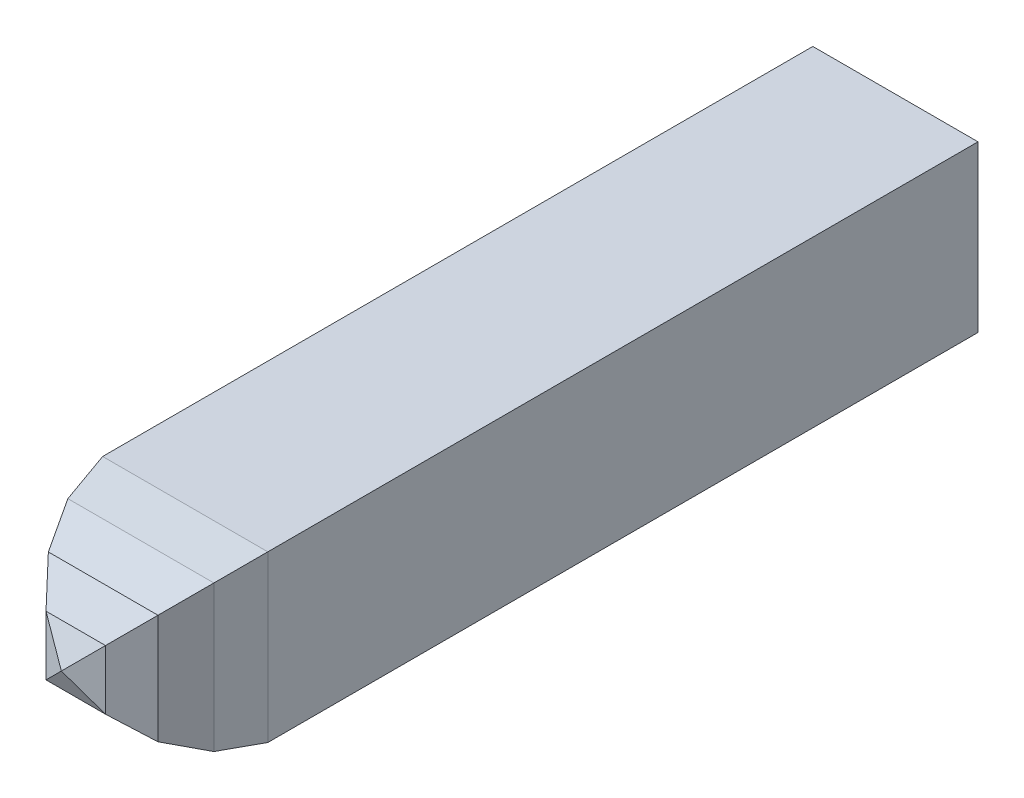
from build123d import *

# Parameters (mm, degrees)
SKETCH1_W           = 101.6
SKETCH1_H           = 101.6
BOSS_EXTRUDE1_DEPTH = 436.88
SHELL1_T            = -1.5875


with BuildPart() as part:
    # Sketch1 → Boss-Extrude1 (new body)
    with BuildSketch(Plane.XY):
        Rectangle(SKETCH1_W, SKETCH1_H)
    extrude(amount=BOSS_EXTRUDE1_DEPTH)

    # Sketch5 → Loft2 section 0
    with BuildSketch(Plane.XY.offset(436.88)):
        with BuildLine():
            Line((50.8, -50.8), (50.8, 50.8))
            Line((50.8, 50.8), (-50.8, 50.8))
            Line((-50.8, 50.8), (-50.8, -50.8))
            Line((-50.8, -50.8), (50.8, -50.8))
        make_face()
    # Sketch3 → Loft2 section 1
    with BuildSketch(Plane.XY.offset(464.156588322)):
        with BuildLine():
            Line((-44.913226277, -44.913226277), (44.913226277, -44.913226277))
            Line((44.913226277, -44.913226277), (44.913226277, 44.913226277))
            Line((44.913226277, 44.913226277), (-44.913226277, 44.913226277))
            Line((-44.913226277, 44.913226277), (-44.913226277, -44.913226277))
        make_face()
    loft()

    # Sketch3<6> → Loft3 section 0
    with BuildSketch(Plane.XY.offset(464.156588322)):
        with BuildLine():
            Line((-44.913226277, -44.913226277), (44.913226277, -44.913226277))
            Line((44.913226277, -44.913226277), (44.913226277, 44.913226277))
            Line((44.913226277, 44.913226277), (-44.913226277, 44.913226277))
            Line((-44.913226277, 44.913226277), (-44.913226277, -44.913226277))
        make_face()
    # Sketch6 → Loft3 section 1
    with BuildSketch(Plane.XY.offset(487.359440316)):
        with BuildLine():
            Line((-33.715917201, -33.715917221), (33.715917201, -33.715917221))
            Line((33.715917201, -33.715917221), (33.715917201, 33.715917221))
            Line((33.715917201, 33.715917221), (-33.715917201, 33.715917221))
            Line((-33.715917201, 33.715917221), (-33.715917201, -33.715917221))
        make_face()
    loft()

    # Sketch6<4> → Loft4 section 0
    with BuildSketch(Plane.XY.offset(487.359440316)):
        with BuildLine():
            Line((-33.715917201, -33.715917221), (33.715917201, -33.715917221))
            Line((33.715917201, -33.715917221), (33.715917201, 33.715917221))
            Line((33.715917201, 33.715917221), (-33.715917201, 33.715917221))
            Line((-33.715917201, 33.715917221), (-33.715917201, -33.715917221))
        make_face()
    # Sketch7 → Loft4 section 1
    with BuildSketch(Plane.XY.offset(504.217299158)):
        with BuildLine():
            Line((-18.304143478, -18.304143458), (18.304143478, -18.304143458))
            Line((18.304143478, -18.304143458), (18.304143478, 18.304143458))
            Line((18.304143478, 18.304143458), (-18.304143478, 18.304143458))
            Line((-18.304143478, 18.304143458), (-18.304143478, -18.304143458))
        make_face()
    loft()

    # Sketch7<5> → Loft5 section 0
    with BuildSketch(Plane.XY.offset(504.217299158), mode=Mode.PRIVATE) as loft5_s0:
        with BuildLine():
            Line((-18.304143478, -18.304143458), (18.304143478, -18.304143458))
            Line((18.304143478, -18.304143458), (18.304143478, 18.304143458))
            Line((18.304143478, 18.304143458), (-18.304143478, 18.304143458))
            Line((-18.304143478, 18.304143458), (-18.304143478, -18.304143458))
        make_face()
    loft([Vertex(0, 0, 513.079999985), loft5_s0.sketch])

    # Shell1
    shell1_openings = [part.faces().sort_by_distance(p)[0] for p in [
        (0, 0, 0),
    ]]
    offset(amount=SHELL1_T, openings=shell1_openings, kind=Kind.INTERSECTION)


solid = part.part
